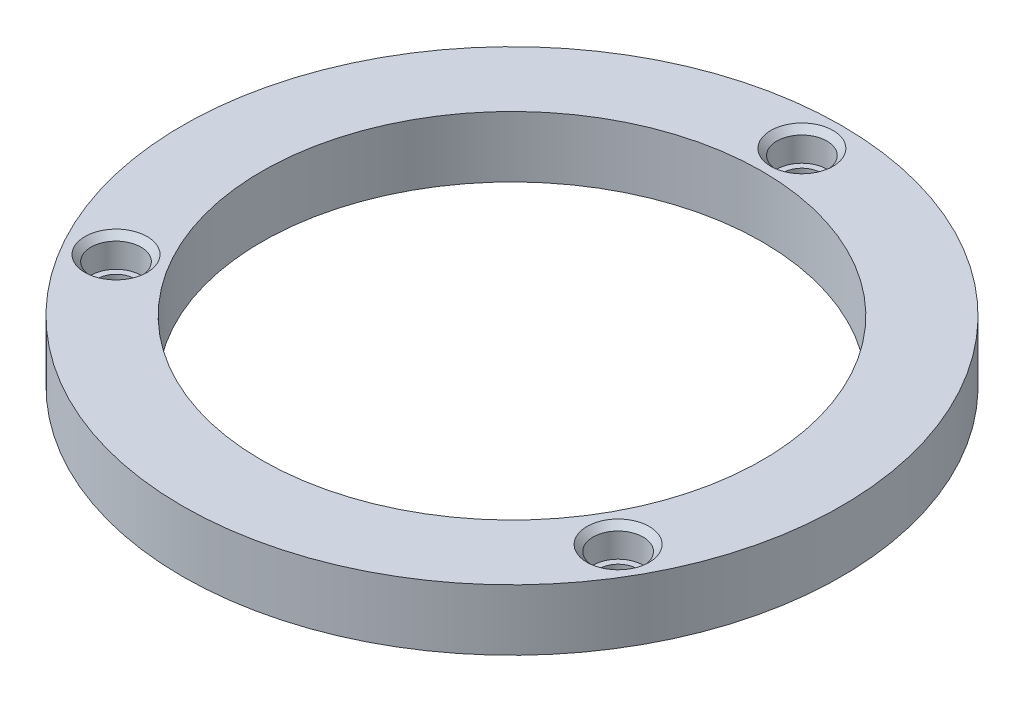
from build123d import *

# Parameters (mm, degrees)
SKETCH1_R           = 54
SKETCH1_R_2         = 41
BOSS_EXTRUDE1_DEPTH = 10
SKETCH2_R           = 4.1
CUT_EXTRUDE1_DEPTH  = 5
CUT_EXTRUDE2_REACH  = 78.531
SKETCH3_R           = 3.1
CHAMFER1_SIZE       = 1


with BuildPart() as part:
    # Sketch1 → Boss-Extrude1 (new body)
    with BuildSketch(Plane(origin=(0, 0, 0), x_dir=(1, 0, 0), z_dir=(0, 1, 0))):
        Circle(SKETCH1_R)
        Circle(SKETCH1_R_2, mode=Mode.SUBTRACT)
    extrude(amount=BOSS_EXTRUDE1_DEPTH)

    # Sketch2 → Cut-Extrude1 (cut)
    with BuildSketch(Plane(origin=(0, 10, 0), x_dir=(1, 0, 0), z_dir=(0, 1, 0))):
        with Locations((0, 47.5)):
            Circle(SKETCH2_R)
        with Locations((41.13620668, -23.75)):
            Circle(SKETCH2_R)
        with Locations((-41.13620668, -23.75)):
            Circle(SKETCH2_R)
    extrude(amount=-CUT_EXTRUDE1_DEPTH, mode=Mode.SUBTRACT)

    # Sketch3 → Cut-Extrude2 (cut, up to next)
    with BuildSketch(Plane(origin=(0, 5, 0), x_dir=(1, 0, 0), z_dir=(0, 1, 0)), mode=Mode.PRIVATE) as cut_extrude2_sk1:
        with Locations((0, 47.5)):
            Circle(SKETCH3_R)
    cut_extrude2_tool1 = extrude(cut_extrude2_sk1.sketch, amount=-CUT_EXTRUDE2_REACH, mode=Mode.PRIVATE) & part.part
    # Sketch3 → Cut-Extrude2 (cut, up to next)
    with BuildSketch(Plane(origin=(0, 5, 0), x_dir=(1, 0, 0), z_dir=(0, 1, 0)), mode=Mode.PRIVATE) as cut_extrude2_sk2:
        with Locations((41.13620668, -23.75)):
            Circle(SKETCH3_R)
    cut_extrude2_tool2 = extrude(cut_extrude2_sk2.sketch, amount=-CUT_EXTRUDE2_REACH, mode=Mode.PRIVATE) & part.part
    # Sketch3 → Cut-Extrude2 (cut, up to next)
    with BuildSketch(Plane(origin=(0, 5, 0), x_dir=(1, 0, 0), z_dir=(0, 1, 0)), mode=Mode.PRIVATE) as cut_extrude2_sk3:
        with Locations((-41.13620668, -23.75)):
            Circle(SKETCH3_R)
    cut_extrude2_tool3 = extrude(cut_extrude2_sk3.sketch, amount=-CUT_EXTRUDE2_REACH, mode=Mode.PRIVATE) & part.part
    add(cut_extrude2_tool1.solids().sort_by_distance((0, 5, -47.5))[0], mode=Mode.SUBTRACT)
    add(cut_extrude2_tool2.solids().sort_by_distance((41.136207, 5, 23.75))[0], mode=Mode.SUBTRACT)
    add(cut_extrude2_tool3.solids().sort_by_distance((-41.136207, 5, 23.75))[0], mode=Mode.SUBTRACT)

    # Chamfer1
    chamfer1_edges = [part.edges().sort_by_distance(p)[0] for p in [
        (-45.23620668, 10, 23.75),
        (37.03620668, 10, 23.75),
        (-4.1, 10, -47.5),
    ]]
    chamfer(chamfer1_edges, length=CHAMFER1_SIZE)


solid = part.part
